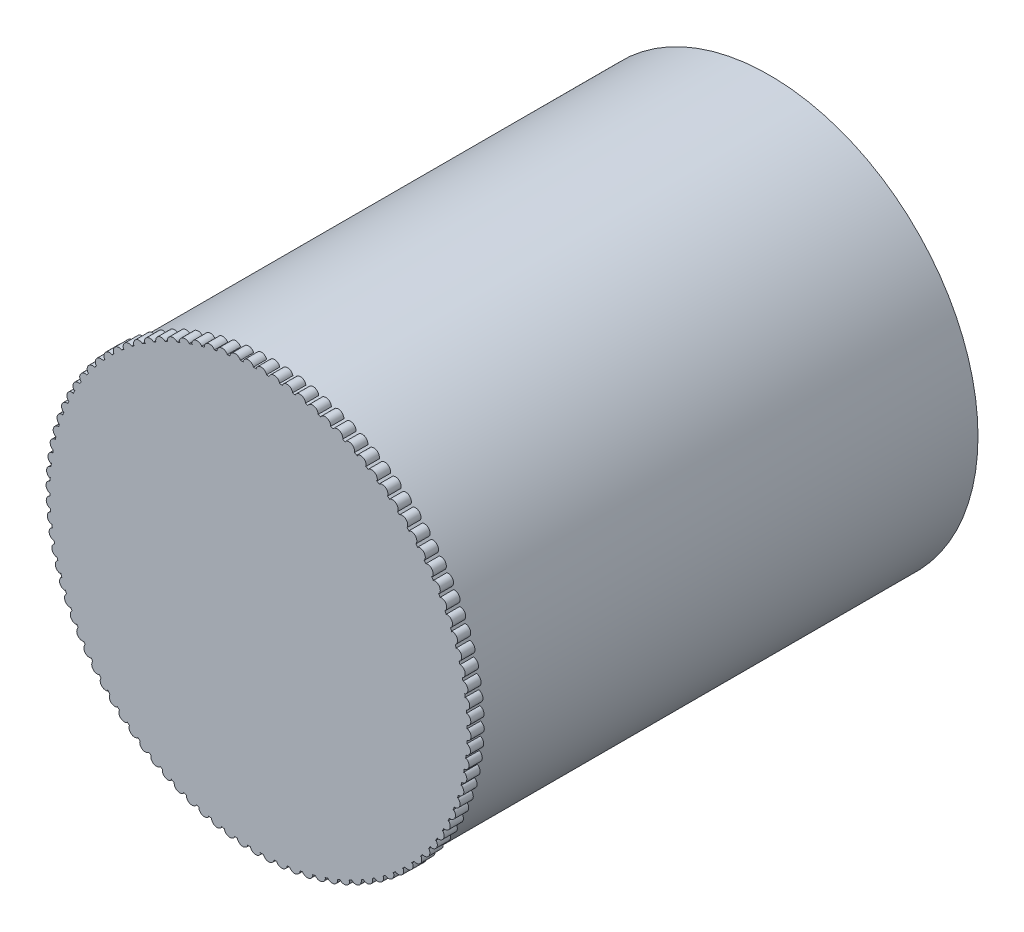
from build123d import *

# Parameters (mm, degrees)
SKETCH1_R           = 20
BOSS_EXTRUDE1_DEPTH = 48.9966
EXTRUDE_THIN2_DEPTH = 1.27


with BuildPart() as part:
    # Sketch1 → Boss-Extrude1 (new body)
    with BuildSketch(Plane.XY):
        Circle(SKETCH1_R)
    extrude(amount=BOSS_EXTRUDE1_DEPTH)

    # Sketch2 → Extrude-Thin2 (add)
    with BuildSketch(Plane.XY.offset(48.9966)):
        with BuildLine():
            ThreePointArc((-1.124338962, 19.868035886), (-0.986464556, 19.975666618), (-0.841626599, 19.877606982))
            Line((-0.841626599, 19.877606982), (-0.483292392, 20.007058117))
            ThreePointArc((-0.483292392, 20.007058117), (-0.999355749, 20.356448468), (-1.490607696, 19.972955924))
            Line((-1.490607696, 19.972955924), (-1.124338962, 19.868035886))
        make_face()
        with BuildLine():
            ThreePointArc((0.125403959, 19.899428684), (0.269764491, 19.998189825), (0.408159429, 19.891229237))
            Line((0.408159429, 19.891229237), (0.773914849, 19.997924938))
            ThreePointArc((0.773914849, 19.997924938), (0.280808226, 20.379029734), (-0.233554043, 20.02713989))
            Line((-0.233554043, 20.02713989), (0.125403959, 19.899428684))
        make_face()
        with BuildLine():
            ThreePointArc((1.374651969, 19.852287527), (1.524928901, 19.941789313), (1.656334637, 19.826349897))
            Line((1.656334637, 19.826349897), (2.028067801, 19.909869086))
            ThreePointArc((2.028067801, 19.909869086), (1.55986398, 20.321184279), (1.02442134, 20.002285884))
            Line((1.02442134, 20.002285884), (1.374651969, 19.852287527))
        make_face()
        with BuildLine():
            ThreePointArc((2.618474855, 19.726798461), (2.774075114, 19.806687669), (2.89797305, 19.683225012))
            Line((2.89797305, 19.683225012), (3.274216896, 19.743238076))
            ThreePointArc((3.274216896, 19.743238076), (2.832763663, 20.183140394), (2.278353801, 19.898491993))
            Line((2.278353801, 19.898491993), (2.618474855, 19.726798461))
        make_face()
        with BuildLine():
            ThreePointArc((3.851963817, 19.523456734), (4.012273319, 19.593418078), (4.128174486, 19.462419431))
            Line((4.128174486, 19.462419431), (4.507444153, 19.498689526))
            ThreePointArc((4.507444153, 19.498689526), (4.094483722, 19.965442875), (3.523294641, 19.716167846))
            Line((3.523294641, 19.716167846), (3.851963817, 19.523456734))
        make_face()
        with BuildLine():
            ThreePointArc((5.070250837, 19.243064842), (5.234636915, 19.302822217), (5.342083904, 19.164804571))
            Line((5.342083904, 19.164804571), (5.722882587, 19.177188556))
            ThreePointArc((5.722882587, 19.177188556), (5.340044724, 19.668950874), (4.754330646, 19.456032992))
            Line((4.754330646, 19.456032992), (5.070250837, 19.243064842))
        make_face()
        with BuildLine():
            ThreePointArc((6.268527894, 18.886729365), (6.43634179, 18.936046935), (6.534910558, 18.791554983))
            Line((6.534910558, 18.791554983), (6.915735418, 18.780003984))
            ThreePointArc((6.915735418, 18.780003984), (6.56453101, 19.29483451), (5.96660348, 19.119114063))
            Line((5.96660348, 19.119114063), (6.268527894, 18.886729365))
        make_face()
        with BuildLine():
            ThreePointArc((7.442065936, 18.455856596), (7.612645364, 18.494539727), (7.701946905, 18.344143713))
            Line((7.701946905, 18.344143713), (8.081295001, 18.308703316))
            ThreePointArc((8.081295001, 18.308703316), (7.763110091, 18.844570249), (7.155328856, 18.706740727))
            Line((7.155328856, 18.706740727), (7.442065936, 18.455856596))
        make_face()
        with BuildLine():
            ThreePointArc((8.586233542, 17.952146993), (8.758905306, 17.98004302), (8.838587186, 17.824336488))
            Line((8.838587186, 17.824336488), (9.214961404, 17.765146561))
            ThreePointArc((9.214961404, 17.765146561), (8.931051722, 18.319935079), (8.315815418, 18.220540431))
            Line((8.315815418, 18.220540431), (8.586233542, 17.952146993))
        make_face()
        with BuildLine():
            ThreePointArc((9.696515208, 17.377588466), (9.870597849, 17.394587298), (9.940345601, 17.23418475))
            Line((9.940345601, 17.23418475), (10.312260565, 17.151478888))
            ThreePointArc((10.312260565, 17.151478888), (10.063746573, 17.722999494), (9.443483255, 17.662431986))
            Line((9.443483255, 17.662431986), (9.696515208, 17.377588466))
        make_face()
        with BuildLine():
            ThreePointArc((10.768529158, 16.734448537), (10.943335653, 16.740483086), (11.002874014, 16.576017559))
            Line((11.002874014, 16.576017559), (11.368861945, 16.470122164))
            ThreePointArc((11.368861945, 16.470122164), (11.156724414, 17.056119327), (10.533881979, 17.034617991))
            Line((10.533881979, 17.034617991), (10.768529158, 16.734448537))
        make_face()
        with BuildLine():
            ThreePointArc((11.798044644, 16.025265385), (11.97288511, 16.020311836), (12.02197911, 15.852432399))
            Line((12.02197911, 15.852432399), (12.38059562, 15.723765392))
            ThreePointArc((12.38059562, 15.723765392), (12.205671761, 16.321926449), (11.582708283, 16.339576142))
            Line((11.582708283, 16.339576142), (11.798044644, 16.025265385))
        make_face()
        with BuildLine():
            ThreePointArc((12.780998637, 15.252837832), (12.955183059, 15.236915734), (12.993638946, 15.066284931))
            Line((12.993638946, 15.066284931), (13.343468741, 14.915354102))
            ThreePointArc((13.343468741, 14.915354102), (13.206448897, 15.523318385), (12.585822928, 15.58004945))
            Line((12.585822928, 15.58004945), (12.780998637, 15.252837832))
        make_face()
        with BuildLine():
            ThreePointArc((13.713511867, 14.420214296), (13.886352819, 14.393386486), (13.914018826, 14.220677719))
            Line((13.914018826, 14.220677719), (14.253681286, 14.048078723))
            ThreePointArc((14.253681286, 14.048078723), (14.155106213, 14.663446875), (13.539267081, 14.759035421))
            Line((13.539267081, 14.759035421), (13.713511867, 14.420214296))
        make_face()
        with BuildLine():
            ThreePointArc((14.591904131, 13.530680763), (14.762719489, 13.493053118), (14.77948643, 13.318947989))
            Line((14.77948643, 13.318947989), (15.107641063, 13.125361996))
            ThreePointArc((15.107641063, 13.125361996), (15.047899792, 13.745705439), (14.439277932, 13.879774222))
            Line((14.439277932, 13.879774222), (14.591904131, 13.530680763))
        make_face()
        with BuildLine():
            ThreePointArc((15.412708817, 12.587747814), (15.58082445, 12.539468833), (15.586626154, 12.364654456))
            Line((15.586626154, 12.364654456), (15.901977884, 12.150845461))
            ThreePointArc((15.901977884, 12.150845461), (15.881306185, 12.773715983), (15.28230355, 12.945735895))
            Line((15.28230355, 12.945735895), (15.412708817, 12.587747814))
        make_face()
        with BuildLine():
            ThreePointArc((16.172686581, 11.595136775), (16.337439015, 11.536396994), (16.332252585, 11.361563281))
            Line((16.332252585, 11.361563281), (16.633556862, 11.12837509))
            ThreePointArc((16.633556862, 11.12837509), (16.652036318, 11.751314506), (16.065016897, 11.960606663))
            Line((16.065016897, 11.960606663), (16.172686581, 11.595136775))
        make_face()
        with BuildLine():
            ThreePointArc((16.868838141, 10.556765029), (17.029577172, 10.487796266), (17.013423076, 10.313633207))
            Line((17.013423076, 10.313633207), (17.29949079, 10.061986107))
            ThreePointArc((17.29949079, 10.061986107), (17.357048471, 10.68253596), (16.784328962, 10.928274381))
            Line((16.784328962, 10.928274381), (16.868838141, 10.556765029))
        make_face()
        with BuildLine():
            ThreePointArc((17.498416103, 9.476730554), (17.654507367, 9.397804998), (17.627449359, 9.224999933))
            Line((17.627449359, 9.224999933), (17.897151532, 8.955887061))
            ThreePointArc((17.897151532, 8.955887061), (17.993560283, 9.571598324), (17.437400949, 9.852813192))
            Line((17.437400949, 9.852813192), (17.498416103, 9.476730554))
        make_face()
        with BuildLine():
            ThreePointArc((18.058935811, 8.359295752), (18.209763288, 8.270724887), (18.171908153, 8.0999598))
            Line((18.171908153, 8.0999598), (18.424180393, 7.814443221))
            ThreePointArc((18.424180393, 7.814443221), (18.559059734, 8.422885963), (18.021655481, 8.738467451))
            Line((18.021655481, 8.738467451), (18.058935811, 8.359295752))
        make_face()
        with BuildLine():
            ThreePointArc((18.548185149, 7.20887063), (18.693153592, 7.111004003), (18.644650727, 6.942952826))
            Line((18.644650727, 6.942952826), (18.878497432, 6.642159344))
            ThreePointArc((18.878497432, 6.642159344), (19.051315054, 7.240932319), (18.534786771, 7.589634971))
            Line((18.534786771, 7.589634971), (18.548185149, 7.20887063))
        make_face()
        with BuildLine():
            ThreePointArc((18.964233275, 6.029995389), (19.10277056, 5.923219236), (19.043811383, 5.758545189))
            Line((19.043811383, 5.758545189), (19.258309665, 5.443661898))
            ThreePointArc((19.258309665, 5.443661898), (19.468383538, 6.030402023), (18.974769726, 6.41084967))
            Line((18.974769726, 6.41084967), (18.964233275, 6.029995389))
        make_face()
        with BuildLine():
            ThreePointArc((19.305438236, 4.827322511), (19.436997619, 4.712058228), (19.367814815, 4.551411205))
            Line((19.367814815, 4.551411205), (19.562118149, 4.223680806))
            ThreePointArc((19.562118149, 4.223680806), (19.808619206, 4.796072486), (19.339867934, 5.206763673))
            Line((19.339867934, 5.206763673), (19.305438236, 4.827322511))
        make_face()
        with BuildLine():
            ThreePointArc((19.570453451, 3.605598396), (19.694515728, 3.482300878), (19.615382331, 3.32631488))
            Line((19.615382331, 3.32631488), (19.788723889, 2.987030775))
            ThreePointArc((19.788723889, 2.987030775), (20.070679304, 3.542815041), (19.628640519, 3.982128959))
            Line((19.628640519, 3.982128959), (19.570453451, 3.605598396))
        make_face()
        with BuildLine():
            ThreePointArc((19.758233028, 2.369644631), (19.874308581, 2.238800479), (19.785536894, 2.08809111))
            Line((19.785536894, 2.08809111), (19.937232577, 1.738592298))
            ThreePointArc((19.937232577, 1.738592298), (20.2535296, 2.275575724), (19.839947826, 2.741778601))
            Line((19.839947826, 2.741778601), (19.758233028, 2.369644631))
        make_face()
        with BuildLine():
            ThreePointArc((19.868035886, 1.124338962), (19.975666618, 0.986464556), (19.877606982, 0.841626599))
            Line((19.877606982, 0.841626599), (20.007058117, 0.483292392))
            ThreePointArc((20.007058117, 0.483292392), (20.356448468, 0.999355749), (19.972955924, 1.490607696))
            Line((19.972955924, 1.490607696), (19.868035886, 1.124338962))
        make_face()
        with BuildLine():
            ThreePointArc((19.899428684, -0.125403959), (19.998189825, -0.269764491), (19.891229237, -0.408159429))
            Line((19.891229237, -0.408159429), (19.997924938, -0.773914849))
            ThreePointArc((19.997924938, -0.773914849), (20.379029734, -0.280808226), (20.02713989, 0.233554043))
            Line((20.02713989, 0.233554043), (19.899428684, -0.125403959))
        make_face()
        with BuildLine():
            ThreePointArc((19.852287527, -1.374651969), (19.941789313, -1.524928901), (19.826349897, -1.656334637))
            Line((19.826349897, -1.656334637), (19.909869086, -2.028067801))
            ThreePointArc((19.909869086, -2.028067801), (20.321184279, -1.55986398), (20.002285884, -1.02442134))
            Line((20.002285884, -1.02442134), (19.852287527, -1.374651969))
        make_face()
        with BuildLine():
            ThreePointArc((19.726798461, -2.618474855), (19.806687669, -2.774075114), (19.683225012, -2.89797305))
            Line((19.683225012, -2.89797305), (19.743238076, -3.274216896))
            ThreePointArc((19.743238076, -3.274216896), (20.183140394, -2.832763663), (19.898491993, -2.278353801))
            Line((19.898491993, -2.278353801), (19.726798461, -2.618474855))
        make_face()
        with BuildLine():
            ThreePointArc((19.523456734, -3.851963817), (19.593418078, -4.012273319), (19.462419431, -4.128174486))
            Line((19.462419431, -4.128174486), (19.498689526, -4.507444153))
            ThreePointArc((19.498689526, -4.507444153), (19.965442875, -4.094483722), (19.716167846, -3.523294641))
            Line((19.716167846, -3.523294641), (19.523456734, -3.851963817))
        make_face()
        with BuildLine():
            ThreePointArc((19.243064842, -5.070250837), (19.302822217, -5.234636915), (19.164804571, -5.342083904))
            Line((19.164804571, -5.342083904), (19.177188556, -5.722882587))
            ThreePointArc((19.177188556, -5.722882587), (19.668950874, -5.340044724), (19.456032992, -4.754330646))
            Line((19.456032992, -4.754330646), (19.243064842, -5.070250837))
        make_face()
        with BuildLine():
            ThreePointArc((18.886729365, -6.268527894), (18.936046935, -6.43634179), (18.791554983, -6.534910558))
            Line((18.791554983, -6.534910558), (18.780003984, -6.915735418))
            ThreePointArc((18.780003984, -6.915735418), (19.29483451, -6.56453101), (19.119114063, -5.96660348))
            Line((19.119114063, -5.96660348), (18.886729365, -6.268527894))
        make_face()
        with BuildLine():
            ThreePointArc((18.455856596, -7.442065936), (18.494539727, -7.612645364), (18.344143713, -7.701946905))
            Line((18.344143713, -7.701946905), (18.308703316, -8.081295001))
            ThreePointArc((18.308703316, -8.081295001), (18.844570249, -7.763110091), (18.706740727, -7.155328856))
            Line((18.706740727, -7.155328856), (18.455856596, -7.442065936))
        make_face()
        with BuildLine():
            ThreePointArc((17.952146993, -8.586233542), (17.98004302, -8.758905306), (17.824336488, -8.838587186))
            Line((17.824336488, -8.838587186), (17.765146561, -9.214961404))
            ThreePointArc((17.765146561, -9.214961404), (18.319935079, -8.931051722), (18.220540431, -8.315815418))
            Line((18.220540431, -8.315815418), (17.952146993, -8.586233542))
        make_face()
        with BuildLine():
            ThreePointArc((17.377588466, -9.696515208), (17.394587298, -9.870597849), (17.23418475, -9.940345601))
            Line((17.23418475, -9.940345601), (17.151478888, -10.312260565))
            ThreePointArc((17.151478888, -10.312260565), (17.722999494, -10.063746573), (17.662431986, -9.443483255))
            Line((17.662431986, -9.443483255), (17.377588466, -9.696515208))
        make_face()
        with BuildLine():
            ThreePointArc((16.734448537, -10.768529158), (16.740483086, -10.943335653), (16.576017559, -11.002874014))
            Line((16.576017559, -11.002874014), (16.470122164, -11.368861945))
            ThreePointArc((16.470122164, -11.368861945), (17.056119327, -11.156724414), (17.034617991, -10.533881979))
            Line((17.034617991, -10.533881979), (16.734448537, -10.768529158))
        make_face()
        with BuildLine():
            ThreePointArc((16.025265385, -11.798044644), (16.020311836, -11.97288511), (15.852432399, -12.02197911))
            Line((15.852432399, -12.02197911), (15.723765392, -12.38059562))
            ThreePointArc((15.723765392, -12.38059562), (16.321926449, -12.205671761), (16.339576142, -11.582708283))
            Line((16.339576142, -11.582708283), (16.025265385, -11.798044644))
        make_face()
        with BuildLine():
            ThreePointArc((15.252837832, -12.780998637), (15.236915734, -12.955183059), (15.066284931, -12.993638946))
            Line((15.066284931, -12.993638946), (14.915354102, -13.343468741))
            ThreePointArc((14.915354102, -13.343468741), (15.523318385, -13.206448897), (15.58004945, -12.585822928))
            Line((15.58004945, -12.585822928), (15.252837832, -12.780998637))
        make_face()
        with BuildLine():
            ThreePointArc((14.420214296, -13.713511867), (14.393386486, -13.886352819), (14.220677719, -13.914018826))
            Line((14.220677719, -13.914018826), (14.048078723, -14.253681286))
            ThreePointArc((14.048078723, -14.253681286), (14.663446875, -14.155106213), (14.759035421, -13.539267081))
            Line((14.759035421, -13.539267081), (14.420214296, -13.713511867))
        make_face()
        with BuildLine():
            ThreePointArc((13.530680763, -14.591904131), (13.493053118, -14.762719489), (13.318947989, -14.77948643))
            Line((13.318947989, -14.77948643), (13.125361996, -15.107641063))
            ThreePointArc((13.125361996, -15.107641063), (13.745705439, -15.047899792), (13.879774222, -14.439277932))
            Line((13.879774222, -14.439277932), (13.530680763, -14.591904131))
        make_face()
        with BuildLine():
            ThreePointArc((12.587747814, -15.412708817), (12.539468833, -15.58082445), (12.364654456, -15.586626154))
            Line((12.364654456, -15.586626154), (12.150845461, -15.901977884))
            ThreePointArc((12.150845461, -15.901977884), (12.773715983, -15.881306185), (12.945735895, -15.28230355))
            Line((12.945735895, -15.28230355), (12.587747814, -15.412708817))
        make_face()
        with BuildLine():
            ThreePointArc((11.595136775, -16.172686581), (11.536396994, -16.337439015), (11.361563281, -16.332252585))
            Line((11.361563281, -16.332252585), (11.12837509, -16.633556862))
            ThreePointArc((11.12837509, -16.633556862), (11.751314506, -16.652036318), (11.960606663, -16.065016897))
            Line((11.960606663, -16.065016897), (11.595136775, -16.172686581))
        make_face()
        with BuildLine():
            ThreePointArc((10.556765029, -16.868838141), (10.487796266, -17.029577172), (10.313633207, -17.013423076))
            Line((10.313633207, -17.013423076), (10.061986107, -17.29949079))
            ThreePointArc((10.061986107, -17.29949079), (10.68253596, -17.357048471), (10.928274381, -16.784328962))
            Line((10.928274381, -16.784328962), (10.556765029, -16.868838141))
        make_face()
        with BuildLine():
            ThreePointArc((9.476730554, -17.498416103), (9.397804998, -17.654507367), (9.224999933, -17.627449359))
            Line((9.224999933, -17.627449359), (8.955887061, -17.897151532))
            ThreePointArc((8.955887061, -17.897151532), (9.571598324, -17.993560283), (9.852813192, -17.437400949))
            Line((9.852813192, -17.437400949), (9.476730554, -17.498416103))
        make_face()
        with BuildLine():
            ThreePointArc((8.359295752, -18.058935811), (8.270724887, -18.209763288), (8.0999598, -18.171908153))
            Line((8.0999598, -18.171908153), (7.814443221, -18.424180393))
            ThreePointArc((7.814443221, -18.424180393), (8.422885963, -18.559059734), (8.738467451, -18.021655481))
            Line((8.738467451, -18.021655481), (8.359295752, -18.058935811))
        make_face()
        with BuildLine():
            ThreePointArc((7.20887063, -18.548185149), (7.111004003, -18.693153592), (6.942952826, -18.644650727))
            Line((6.942952826, -18.644650727), (6.642159344, -18.878497432))
            ThreePointArc((6.642159344, -18.878497432), (7.240932319, -19.051315054), (7.589634971, -18.534786771))
            Line((7.589634971, -18.534786771), (7.20887063, -18.548185149))
        make_face()
        with BuildLine():
            ThreePointArc((6.029995389, -18.964233275), (5.923219236, -19.10277056), (5.758545189, -19.043811383))
            Line((5.758545189, -19.043811383), (5.443661898, -19.258309665))
            ThreePointArc((5.443661898, -19.258309665), (6.030402023, -19.468383538), (6.41084967, -18.974769726))
            Line((6.41084967, -18.974769726), (6.029995389, -18.964233275))
        make_face()
        with BuildLine():
            ThreePointArc((4.827322511, -19.305438236), (4.712058228, -19.436997619), (4.551411205, -19.367814815))
            Line((4.551411205, -19.367814815), (4.223680806, -19.562118149))
            ThreePointArc((4.223680806, -19.562118149), (4.796072486, -19.808619206), (5.206763673, -19.339867934))
            Line((5.206763673, -19.339867934), (4.827322511, -19.305438236))
        make_face()
        with BuildLine():
            ThreePointArc((3.605598396, -19.570453451), (3.482300878, -19.694515728), (3.32631488, -19.615382331))
            Line((3.32631488, -19.615382331), (2.987030775, -19.788723889))
            ThreePointArc((2.987030775, -19.788723889), (3.542815041, -20.070679304), (3.982128959, -19.628640519))
            Line((3.982128959, -19.628640519), (3.605598396, -19.570453451))
        make_face()
        with BuildLine():
            ThreePointArc((2.369644631, -19.758233028), (2.238800479, -19.874308581), (2.08809111, -19.785536894))
            Line((2.08809111, -19.785536894), (1.738592298, -19.937232577))
            ThreePointArc((1.738592298, -19.937232577), (2.275575724, -20.2535296), (2.741778601, -19.839947826))
            Line((2.741778601, -19.839947826), (2.369644631, -19.758233028))
        make_face()
        with BuildLine():
            ThreePointArc((1.124338962, -19.868035886), (0.986464556, -19.975666618), (0.841626599, -19.877606982))
            Line((0.841626599, -19.877606982), (0.483292392, -20.007058117))
            ThreePointArc((0.483292392, -20.007058117), (0.999355749, -20.356448468), (1.490607696, -19.972955924))
            Line((1.490607696, -19.972955924), (1.124338962, -19.868035886))
        make_face()
        with BuildLine():
            ThreePointArc((-0.125403959, -19.899428684), (-0.269764491, -19.998189825), (-0.408159429, -19.891229237))
            Line((-0.408159429, -19.891229237), (-0.773914849, -19.997924938))
            ThreePointArc((-0.773914849, -19.997924938), (-0.280808226, -20.379029734), (0.233554043, -20.02713989))
            Line((0.233554043, -20.02713989), (-0.125403959, -19.899428684))
        make_face()
        with BuildLine():
            ThreePointArc((-1.374651969, -19.852287527), (-1.524928901, -19.941789313), (-1.656334637, -19.826349897))
            Line((-1.656334637, -19.826349897), (-2.028067801, -19.909869086))
            ThreePointArc((-2.028067801, -19.909869086), (-1.55986398, -20.321184279), (-1.02442134, -20.002285884))
            Line((-1.02442134, -20.002285884), (-1.374651969, -19.852287527))
        make_face()
        with BuildLine():
            ThreePointArc((-2.618474855, -19.726798461), (-2.774075114, -19.806687669), (-2.89797305, -19.683225012))
            Line((-2.89797305, -19.683225012), (-3.274216896, -19.743238076))
            ThreePointArc((-3.274216896, -19.743238076), (-2.832763663, -20.183140394), (-2.278353801, -19.898491993))
            Line((-2.278353801, -19.898491993), (-2.618474855, -19.726798461))
        make_face()
        with BuildLine():
            ThreePointArc((-3.851963817, -19.523456734), (-4.012273319, -19.593418078), (-4.128174486, -19.462419431))
            Line((-4.128174486, -19.462419431), (-4.507444153, -19.498689526))
            ThreePointArc((-4.507444153, -19.498689526), (-4.094483722, -19.965442875), (-3.523294641, -19.716167846))
            Line((-3.523294641, -19.716167846), (-3.851963817, -19.523456734))
        make_face()
        with BuildLine():
            ThreePointArc((-5.070250837, -19.243064842), (-5.234636915, -19.302822217), (-5.342083904, -19.164804571))
            Line((-5.342083904, -19.164804571), (-5.722882587, -19.177188556))
            ThreePointArc((-5.722882587, -19.177188556), (-5.340044724, -19.668950874), (-4.754330646, -19.456032992))
            Line((-4.754330646, -19.456032992), (-5.070250837, -19.243064842))
        make_face()
        with BuildLine():
            ThreePointArc((-6.268527894, -18.886729365), (-6.43634179, -18.936046935), (-6.534910558, -18.791554983))
            Line((-6.534910558, -18.791554983), (-6.915735418, -18.780003984))
            ThreePointArc((-6.915735418, -18.780003984), (-6.56453101, -19.29483451), (-5.96660348, -19.119114063))
            Line((-5.96660348, -19.119114063), (-6.268527894, -18.886729365))
        make_face()
        with BuildLine():
            ThreePointArc((-7.442065936, -18.455856596), (-7.612645364, -18.494539727), (-7.701946905, -18.344143713))
            Line((-7.701946905, -18.344143713), (-8.081295001, -18.308703316))
            ThreePointArc((-8.081295001, -18.308703316), (-7.763110091, -18.844570249), (-7.155328856, -18.706740727))
            Line((-7.155328856, -18.706740727), (-7.442065936, -18.455856596))
        make_face()
        with BuildLine():
            ThreePointArc((-8.586233542, -17.952146993), (-8.758905306, -17.98004302), (-8.838587186, -17.824336488))
            Line((-8.838587186, -17.824336488), (-9.214961404, -17.765146561))
            ThreePointArc((-9.214961404, -17.765146561), (-8.931051722, -18.319935079), (-8.315815418, -18.220540431))
            Line((-8.315815418, -18.220540431), (-8.586233542, -17.952146993))
        make_face()
        with BuildLine():
            ThreePointArc((-9.696515208, -17.377588466), (-9.870597849, -17.394587298), (-9.940345601, -17.23418475))
            Line((-9.940345601, -17.23418475), (-10.312260565, -17.151478888))
            ThreePointArc((-10.312260565, -17.151478888), (-10.063746573, -17.722999494), (-9.443483255, -17.662431986))
            Line((-9.443483255, -17.662431986), (-9.696515208, -17.377588466))
        make_face()
        with BuildLine():
            ThreePointArc((-10.768529158, -16.734448537), (-10.943335653, -16.740483086), (-11.002874014, -16.576017559))
            Line((-11.002874014, -16.576017559), (-11.368861945, -16.470122164))
            ThreePointArc((-11.368861945, -16.470122164), (-11.156724414, -17.056119327), (-10.533881979, -17.034617991))
            Line((-10.533881979, -17.034617991), (-10.768529158, -16.734448537))
        make_face()
        with BuildLine():
            ThreePointArc((-11.798044644, -16.025265385), (-11.97288511, -16.020311836), (-12.02197911, -15.852432399))
            Line((-12.02197911, -15.852432399), (-12.38059562, -15.723765392))
            ThreePointArc((-12.38059562, -15.723765392), (-12.205671761, -16.321926449), (-11.582708283, -16.339576142))
            Line((-11.582708283, -16.339576142), (-11.798044644, -16.025265385))
        make_face()
        with BuildLine():
            ThreePointArc((-12.780998637, -15.252837832), (-12.955183059, -15.236915734), (-12.993638946, -15.066284931))
            Line((-12.993638946, -15.066284931), (-13.343468741, -14.915354102))
            ThreePointArc((-13.343468741, -14.915354102), (-13.206448897, -15.523318385), (-12.585822928, -15.58004945))
            Line((-12.585822928, -15.58004945), (-12.780998637, -15.252837832))
        make_face()
        with BuildLine():
            ThreePointArc((-13.713511867, -14.420214296), (-13.886352819, -14.393386486), (-13.914018826, -14.220677719))
            Line((-13.914018826, -14.220677719), (-14.253681286, -14.048078723))
            ThreePointArc((-14.253681286, -14.048078723), (-14.155106213, -14.663446875), (-13.539267081, -14.759035421))
            Line((-13.539267081, -14.759035421), (-13.713511867, -14.420214296))
        make_face()
        with BuildLine():
            ThreePointArc((-14.591904131, -13.530680763), (-14.762719489, -13.493053118), (-14.77948643, -13.318947989))
            Line((-14.77948643, -13.318947989), (-15.107641063, -13.125361996))
            ThreePointArc((-15.107641063, -13.125361996), (-15.047899792, -13.745705439), (-14.439277932, -13.879774222))
            Line((-14.439277932, -13.879774222), (-14.591904131, -13.530680763))
        make_face()
        with BuildLine():
            ThreePointArc((-15.412708817, -12.587747814), (-15.58082445, -12.539468833), (-15.586626154, -12.364654456))
            Line((-15.586626154, -12.364654456), (-15.901977884, -12.150845461))
            ThreePointArc((-15.901977884, -12.150845461), (-15.881306185, -12.773715983), (-15.28230355, -12.945735895))
            Line((-15.28230355, -12.945735895), (-15.412708817, -12.587747814))
        make_face()
        with BuildLine():
            ThreePointArc((-16.172686581, -11.595136775), (-16.337439015, -11.536396994), (-16.332252585, -11.361563281))
            Line((-16.332252585, -11.361563281), (-16.633556862, -11.12837509))
            ThreePointArc((-16.633556862, -11.12837509), (-16.652036318, -11.751314506), (-16.065016897, -11.960606663))
            Line((-16.065016897, -11.960606663), (-16.172686581, -11.595136775))
        make_face()
        with BuildLine():
            ThreePointArc((-16.868838141, -10.556765029), (-17.029577172, -10.487796266), (-17.013423076, -10.313633207))
            Line((-17.013423076, -10.313633207), (-17.29949079, -10.061986107))
            ThreePointArc((-17.29949079, -10.061986107), (-17.357048471, -10.68253596), (-16.784328962, -10.928274381))
            Line((-16.784328962, -10.928274381), (-16.868838141, -10.556765029))
        make_face()
        with BuildLine():
            ThreePointArc((-17.498416103, -9.476730554), (-17.654507367, -9.397804998), (-17.627449359, -9.224999933))
            Line((-17.627449359, -9.224999933), (-17.897151532, -8.955887061))
            ThreePointArc((-17.897151532, -8.955887061), (-17.993560283, -9.571598324), (-17.437400949, -9.852813192))
            Line((-17.437400949, -9.852813192), (-17.498416103, -9.476730554))
        make_face()
        with BuildLine():
            ThreePointArc((-18.058935811, -8.359295752), (-18.209763288, -8.270724887), (-18.171908153, -8.0999598))
            Line((-18.171908153, -8.0999598), (-18.424180393, -7.814443221))
            ThreePointArc((-18.424180393, -7.814443221), (-18.559059734, -8.422885963), (-18.021655481, -8.738467451))
            Line((-18.021655481, -8.738467451), (-18.058935811, -8.359295752))
        make_face()
        with BuildLine():
            ThreePointArc((-18.548185149, -7.20887063), (-18.693153592, -7.111004003), (-18.644650727, -6.942952826))
            Line((-18.644650727, -6.942952826), (-18.878497432, -6.642159344))
            ThreePointArc((-18.878497432, -6.642159344), (-19.051315054, -7.240932319), (-18.534786771, -7.589634971))
            Line((-18.534786771, -7.589634971), (-18.548185149, -7.20887063))
        make_face()
        with BuildLine():
            ThreePointArc((-18.964233275, -6.029995389), (-19.10277056, -5.923219236), (-19.043811383, -5.758545189))
            Line((-19.043811383, -5.758545189), (-19.258309665, -5.443661898))
            ThreePointArc((-19.258309665, -5.443661898), (-19.468383538, -6.030402023), (-18.974769726, -6.41084967))
            Line((-18.974769726, -6.41084967), (-18.964233275, -6.029995389))
        make_face()
        with BuildLine():
            ThreePointArc((-19.305438236, -4.827322511), (-19.436997619, -4.712058228), (-19.367814815, -4.551411205))
            Line((-19.367814815, -4.551411205), (-19.562118149, -4.223680806))
            ThreePointArc((-19.562118149, -4.223680806), (-19.808619206, -4.796072486), (-19.339867934, -5.206763673))
            Line((-19.339867934, -5.206763673), (-19.305438236, -4.827322511))
        make_face()
        with BuildLine():
            ThreePointArc((-19.570453451, -3.605598396), (-19.694515728, -3.482300878), (-19.615382331, -3.32631488))
            Line((-19.615382331, -3.32631488), (-19.788723889, -2.987030775))
            ThreePointArc((-19.788723889, -2.987030775), (-20.070679304, -3.542815041), (-19.628640519, -3.982128959))
            Line((-19.628640519, -3.982128959), (-19.570453451, -3.605598396))
        make_face()
        with BuildLine():
            ThreePointArc((-19.758233028, -2.369644631), (-19.874308581, -2.238800479), (-19.785536894, -2.08809111))
            Line((-19.785536894, -2.08809111), (-19.937232577, -1.738592298))
            ThreePointArc((-19.937232577, -1.738592298), (-20.2535296, -2.275575724), (-19.839947826, -2.741778601))
            Line((-19.839947826, -2.741778601), (-19.758233028, -2.369644631))
        make_face()
        with BuildLine():
            ThreePointArc((-19.868035886, -1.124338962), (-19.975666618, -0.986464556), (-19.877606982, -0.841626599))
            Line((-19.877606982, -0.841626599), (-20.007058117, -0.483292392))
            ThreePointArc((-20.007058117, -0.483292392), (-20.356448468, -0.999355749), (-19.972955924, -1.490607696))
            Line((-19.972955924, -1.490607696), (-19.868035886, -1.124338962))
        make_face()
        with BuildLine():
            ThreePointArc((-19.899428684, 0.125403959), (-19.998189825, 0.269764491), (-19.891229237, 0.408159429))
            Line((-19.891229237, 0.408159429), (-19.997924938, 0.773914849))
            ThreePointArc((-19.997924938, 0.773914849), (-20.379029734, 0.280808226), (-20.02713989, -0.233554043))
            Line((-20.02713989, -0.233554043), (-19.899428684, 0.125403959))
        make_face()
        with BuildLine():
            ThreePointArc((-19.852287527, 1.374651969), (-19.941789313, 1.524928901), (-19.826349897, 1.656334637))
            Line((-19.826349897, 1.656334637), (-19.909869086, 2.028067801))
            ThreePointArc((-19.909869086, 2.028067801), (-20.321184279, 1.55986398), (-20.002285884, 1.02442134))
            Line((-20.002285884, 1.02442134), (-19.852287527, 1.374651969))
        make_face()
        with BuildLine():
            ThreePointArc((-19.726798461, 2.618474855), (-19.806687669, 2.774075114), (-19.683225012, 2.89797305))
            Line((-19.683225012, 2.89797305), (-19.743238076, 3.274216896))
            ThreePointArc((-19.743238076, 3.274216896), (-20.183140394, 2.832763663), (-19.898491993, 2.278353801))
            Line((-19.898491993, 2.278353801), (-19.726798461, 2.618474855))
        make_face()
        with BuildLine():
            ThreePointArc((-19.523456734, 3.851963817), (-19.593418078, 4.012273319), (-19.462419431, 4.128174486))
            Line((-19.462419431, 4.128174486), (-19.498689526, 4.507444153))
            ThreePointArc((-19.498689526, 4.507444153), (-19.965442875, 4.094483722), (-19.716167846, 3.523294641))
            Line((-19.716167846, 3.523294641), (-19.523456734, 3.851963817))
        make_face()
        with BuildLine():
            ThreePointArc((-19.243064842, 5.070250837), (-19.302822217, 5.234636915), (-19.164804571, 5.342083904))
            Line((-19.164804571, 5.342083904), (-19.177188556, 5.722882587))
            ThreePointArc((-19.177188556, 5.722882587), (-19.668950874, 5.340044724), (-19.456032992, 4.754330646))
            Line((-19.456032992, 4.754330646), (-19.243064842, 5.070250837))
        make_face()
        with BuildLine():
            ThreePointArc((-18.886729365, 6.268527894), (-18.936046935, 6.43634179), (-18.791554983, 6.534910558))
            Line((-18.791554983, 6.534910558), (-18.780003984, 6.915735418))
            ThreePointArc((-18.780003984, 6.915735418), (-19.29483451, 6.56453101), (-19.119114063, 5.96660348))
            Line((-19.119114063, 5.96660348), (-18.886729365, 6.268527894))
        make_face()
        with BuildLine():
            ThreePointArc((-18.455856596, 7.442065936), (-18.494539727, 7.612645364), (-18.344143713, 7.701946905))
            Line((-18.344143713, 7.701946905), (-18.308703316, 8.081295001))
            ThreePointArc((-18.308703316, 8.081295001), (-18.844570249, 7.763110091), (-18.706740727, 7.155328856))
            Line((-18.706740727, 7.155328856), (-18.455856596, 7.442065936))
        make_face()
        with BuildLine():
            ThreePointArc((-17.952146993, 8.586233542), (-17.98004302, 8.758905306), (-17.824336488, 8.838587186))
            Line((-17.824336488, 8.838587186), (-17.765146561, 9.214961404))
            ThreePointArc((-17.765146561, 9.214961404), (-18.319935079, 8.931051722), (-18.220540431, 8.315815418))
            Line((-18.220540431, 8.315815418), (-17.952146993, 8.586233542))
        make_face()
        with BuildLine():
            ThreePointArc((-17.377588466, 9.696515208), (-17.394587298, 9.870597849), (-17.23418475, 9.940345601))
            Line((-17.23418475, 9.940345601), (-17.151478888, 10.312260565))
            ThreePointArc((-17.151478888, 10.312260565), (-17.722999494, 10.063746573), (-17.662431986, 9.443483255))
            Line((-17.662431986, 9.443483255), (-17.377588466, 9.696515208))
        make_face()
        with BuildLine():
            ThreePointArc((-16.734448537, 10.768529158), (-16.740483086, 10.943335653), (-16.576017559, 11.002874014))
            Line((-16.576017559, 11.002874014), (-16.470122164, 11.368861945))
            ThreePointArc((-16.470122164, 11.368861945), (-17.056119327, 11.156724414), (-17.034617991, 10.533881979))
            Line((-17.034617991, 10.533881979), (-16.734448537, 10.768529158))
        make_face()
        with BuildLine():
            ThreePointArc((-16.025265385, 11.798044644), (-16.020311836, 11.97288511), (-15.852432399, 12.02197911))
            Line((-15.852432399, 12.02197911), (-15.723765392, 12.38059562))
            ThreePointArc((-15.723765392, 12.38059562), (-16.321926449, 12.205671761), (-16.339576142, 11.582708283))
            Line((-16.339576142, 11.582708283), (-16.025265385, 11.798044644))
        make_face()
        with BuildLine():
            ThreePointArc((-15.252837832, 12.780998637), (-15.236915734, 12.955183059), (-15.066284931, 12.993638946))
            Line((-15.066284931, 12.993638946), (-14.915354102, 13.343468741))
            ThreePointArc((-14.915354102, 13.343468741), (-15.523318385, 13.206448897), (-15.58004945, 12.585822928))
            Line((-15.58004945, 12.585822928), (-15.252837832, 12.780998637))
        make_face()
        with BuildLine():
            ThreePointArc((-14.420214296, 13.713511867), (-14.393386486, 13.886352819), (-14.220677719, 13.914018826))
            Line((-14.220677719, 13.914018826), (-14.048078723, 14.253681286))
            ThreePointArc((-14.048078723, 14.253681286), (-14.663446875, 14.155106213), (-14.759035421, 13.539267081))
            Line((-14.759035421, 13.539267081), (-14.420214296, 13.713511867))
        make_face()
        with BuildLine():
            ThreePointArc((-13.530680763, 14.591904131), (-13.493053118, 14.762719489), (-13.318947989, 14.77948643))
            Line((-13.318947989, 14.77948643), (-13.125361996, 15.107641063))
            ThreePointArc((-13.125361996, 15.107641063), (-13.745705439, 15.047899792), (-13.879774222, 14.439277932))
            Line((-13.879774222, 14.439277932), (-13.530680763, 14.591904131))
        make_face()
        with BuildLine():
            ThreePointArc((-12.587747814, 15.412708817), (-12.539468833, 15.58082445), (-12.364654456, 15.586626154))
            Line((-12.364654456, 15.586626154), (-12.150845461, 15.901977884))
            ThreePointArc((-12.150845461, 15.901977884), (-12.773715983, 15.881306185), (-12.945735895, 15.28230355))
            Line((-12.945735895, 15.28230355), (-12.587747814, 15.412708817))
        make_face()
        with BuildLine():
            ThreePointArc((-11.595136775, 16.172686581), (-11.536396994, 16.337439015), (-11.361563281, 16.332252585))
            Line((-11.361563281, 16.332252585), (-11.12837509, 16.633556862))
            ThreePointArc((-11.12837509, 16.633556862), (-11.751314506, 16.652036318), (-11.960606663, 16.065016897))
            Line((-11.960606663, 16.065016897), (-11.595136775, 16.172686581))
        make_face()
        with BuildLine():
            ThreePointArc((-10.556765029, 16.868838141), (-10.487796266, 17.029577172), (-10.313633207, 17.013423076))
            Line((-10.313633207, 17.013423076), (-10.061986107, 17.29949079))
            ThreePointArc((-10.061986107, 17.29949079), (-10.68253596, 17.357048471), (-10.928274381, 16.784328962))
            Line((-10.928274381, 16.784328962), (-10.556765029, 16.868838141))
        make_face()
        with BuildLine():
            ThreePointArc((-9.476730554, 17.498416103), (-9.397804998, 17.654507367), (-9.224999933, 17.627449359))
            Line((-9.224999933, 17.627449359), (-8.955887061, 17.897151532))
            ThreePointArc((-8.955887061, 17.897151532), (-9.571598324, 17.993560283), (-9.852813192, 17.437400949))
            Line((-9.852813192, 17.437400949), (-9.476730554, 17.498416103))
        make_face()
        with BuildLine():
            ThreePointArc((-8.359295752, 18.058935811), (-8.270724887, 18.209763288), (-8.0999598, 18.171908153))
            Line((-8.0999598, 18.171908153), (-7.814443221, 18.424180393))
            ThreePointArc((-7.814443221, 18.424180393), (-8.422885963, 18.559059734), (-8.738467451, 18.021655481))
            Line((-8.738467451, 18.021655481), (-8.359295752, 18.058935811))
        make_face()
        with BuildLine():
            ThreePointArc((-7.20887063, 18.548185149), (-7.111004003, 18.693153592), (-6.942952826, 18.644650727))
            Line((-6.942952826, 18.644650727), (-6.642159344, 18.878497432))
            ThreePointArc((-6.642159344, 18.878497432), (-7.240932319, 19.051315054), (-7.589634971, 18.534786771))
            Line((-7.589634971, 18.534786771), (-7.20887063, 18.548185149))
        make_face()
        with BuildLine():
            ThreePointArc((-6.029995389, 18.964233275), (-5.923219236, 19.10277056), (-5.758545189, 19.043811383))
            Line((-5.758545189, 19.043811383), (-5.443661898, 19.258309665))
            ThreePointArc((-5.443661898, 19.258309665), (-6.030402023, 19.468383538), (-6.41084967, 18.974769726))
            Line((-6.41084967, 18.974769726), (-6.029995389, 18.964233275))
        make_face()
        with BuildLine():
            ThreePointArc((-4.827322511, 19.305438236), (-4.712058228, 19.436997619), (-4.551411205, 19.367814815))
            Line((-4.551411205, 19.367814815), (-4.223680806, 19.562118149))
            ThreePointArc((-4.223680806, 19.562118149), (-4.796072486, 19.808619206), (-5.206763673, 19.339867934))
            Line((-5.206763673, 19.339867934), (-4.827322511, 19.305438236))
        make_face()
        with BuildLine():
            ThreePointArc((-3.605598396, 19.570453451), (-3.482300878, 19.694515728), (-3.32631488, 19.615382331))
            Line((-3.32631488, 19.615382331), (-2.987030775, 19.788723889))
            ThreePointArc((-2.987030775, 19.788723889), (-3.542815041, 20.070679304), (-3.982128959, 19.628640519))
            Line((-3.982128959, 19.628640519), (-3.605598396, 19.570453451))
        make_face()
        with BuildLine():
            ThreePointArc((-2.369644631, 19.758233028), (-2.238800479, 19.874308581), (-2.08809111, 19.785536894))
            Line((-2.08809111, 19.785536894), (-1.738592298, 19.937232577))
            ThreePointArc((-1.738592298, 19.937232577), (-2.275575724, 20.2535296), (-2.741778601, 19.839947826))
            Line((-2.741778601, 19.839947826), (-2.369644631, 19.758233028))
        make_face()
    extrude(amount=-EXTRUDE_THIN2_DEPTH)


solid = part.part
